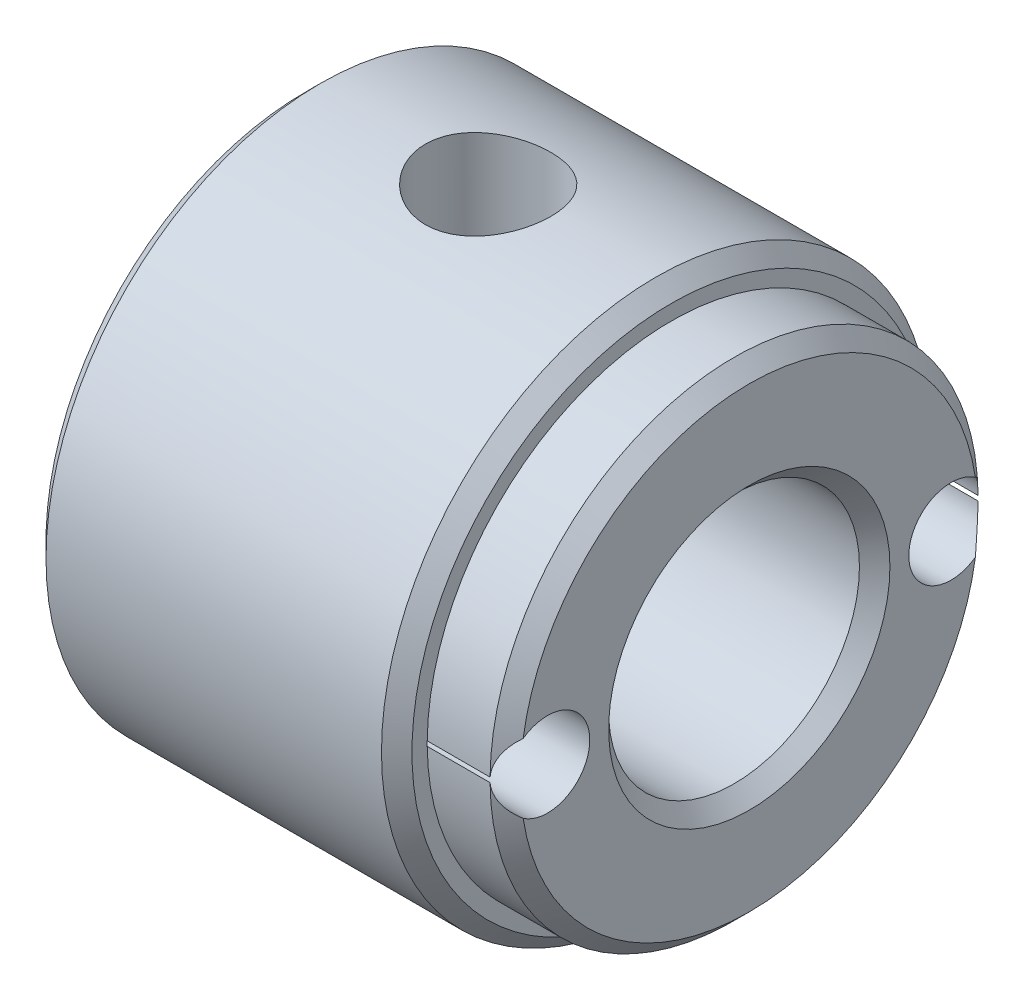
from build123d import *

# Parameters (mm, degrees)
SKETCH1_R                                 = 3.2639
INNER_SIDE_EXTRUDE_DEPTH                  = 2.032
OUTER_START                               = -9.525
SKETCH1_3_R                               = 7.14375
SKETCH1_3_R_2                             = 1.099999959
SKETCH1_3_R_3                             = 3.2639
OUTER_SIDE_EXTRUDE_DEPTH                  = 9.525
CLEVIS_PIN_CUT_DEPTH                      = 14.8849542
CLEVIS_PIN_CUT_DEPTH_BACK                 = 14.8849542
SKETCH2_R                                 = 1.63195
CHAMFER_SO_STEVE_DOESN_T_CUT_HIMSELF_SIZE = 0.396875


with BuildPart() as part:
    # Sketch1 → Inner Side Extrude (new body)
    with BuildSketch(Plane(origin=(0, 0, 0), x_dir=(0, 0, -1), z_dir=(1, 0, 0))):
        with BuildLine():
            ThreePointArc((6.349696483, -0.0620852), (4.151450041, 0), (6.349696483, 0.0620852))
            ThreePointArc((6.349696483, 0.0620852), (0, 6.35), (-6.349696483, 0.0620852))
            ThreePointArc((-6.349696483, 0.0620852), (-5.220395021, 1.099561503), (-4.151450041, 0))
            ThreePointArc((-4.151450041, 0), (-5.220395021, -1.099561503), (-6.349696483, -0.0620852))
            ThreePointArc((-6.349696483, -0.0620852), (0, -6.35), (6.349696483, -0.0620852))
        make_face()
        Circle(SKETCH1_R, mode=Mode.SUBTRACT)
    extrude(amount=INNER_SIDE_EXTRUDE_DEPTH)

    # Sketch1<3> → Outer Side Extrude (add)
    with BuildSketch(Plane(origin=(0, 0, 0), x_dir=(0, 0, -1), z_dir=(1, 0, 0)).offset(OUTER_START)):
        Circle(SKETCH1_3_R)
        with Locations((5.25145, 0)):
            Circle(SKETCH1_3_R_2, mode=Mode.SUBTRACT)
        with Locations((-5.25145, 0)):
            Circle(SKETCH1_3_R_2, mode=Mode.SUBTRACT)
        Circle(SKETCH1_3_R_3, mode=Mode.SUBTRACT)
    extrude(amount=OUTER_SIDE_EXTRUDE_DEPTH)

    # Sketch2 → Clevis Pin Cut (cut, two sides: drawn at the far end of the back side and taken through both)
    with BuildSketch(Plane(origin=(0, 0, 0), x_dir=(1, 0, 0), z_dir=(0, 1, 0)).offset(-CLEVIS_PIN_CUT_DEPTH_BACK)):
        with Locations((-4.7625, 0)):
            Circle(SKETCH2_R)
    extrude(amount=CLEVIS_PIN_CUT_DEPTH + CLEVIS_PIN_CUT_DEPTH_BACK, mode=Mode.SUBTRACT)

    # Chamfer so Steve Doesn't cut himself
    chamfer_so_steve_doesn_t_cut_himself_edges = [part.edges().sort_by_distance(p)[0] for p in [
        (-9.525, 0, 3.2639),
        (2.032, 0, 3.2639),
        (-9.525, 0, 7.14375),
        (0, 0, 7.14375),
        (2.032, 6.35, 0),
        (2.032, -6.35, 0),
    ]]
    chamfer(chamfer_so_steve_doesn_t_cut_himself_edges, length=CHAMFER_SO_STEVE_DOESN_T_CUT_HIMSELF_SIZE)


solid = part.part
